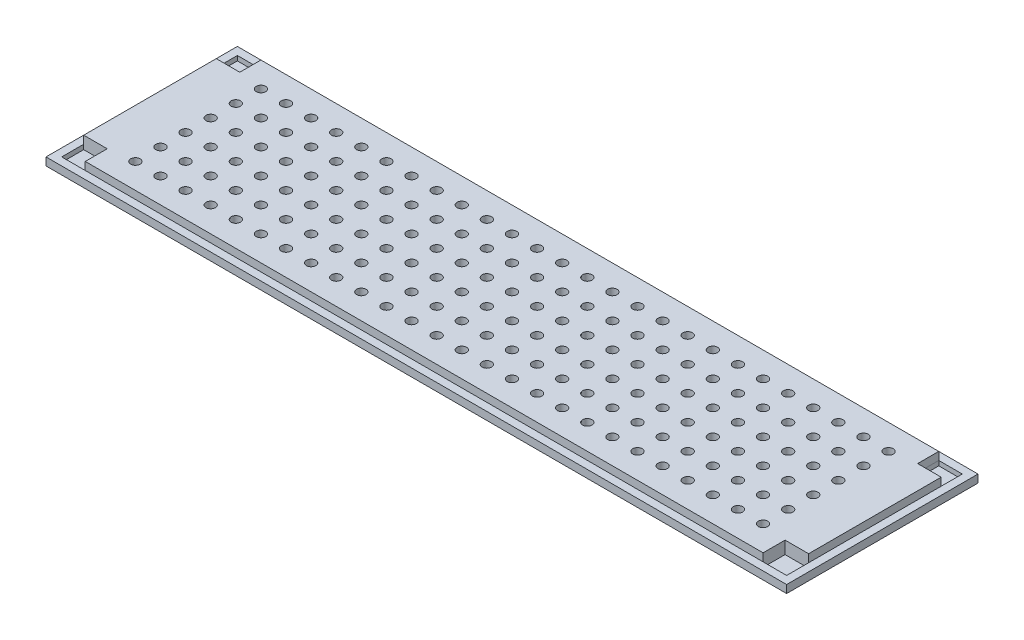
from build123d import *

# Parameters (mm, degrees)
SKETCH1_W           = 236
SKETCH1_H           = 60.98
BOSS_EXTRUDE2_DEPTH = 2.5
BOSS_EXTRUDE3_DEPTH = 2.5
SKETCH4_W           = 7.502299771
SKETCH4_H           = 6.733304844
CUT_EXTRUDE2_DEPTH  = 1.5
SKETCH5_R           = 1.5
CUT_EXTRUDE3_DEPTH  = 10


with BuildPart() as part:
    # Sketch1 → Boss-Extrude2 (new body)
    with BuildSketch(Plane(origin=(0, 0, 0), x_dir=(1, 0, 0), z_dir=(0, 1, 0))):
        Rectangle(SKETCH1_W, SKETCH1_H)
    extrude(amount=BOSS_EXTRUDE2_DEPTH)

    # Sketch2 → Boss-Extrude3 (add)
    with BuildSketch(Plane(origin=(0, 2.5, 0), x_dir=(1, 0, 0), z_dir=(0, 1, 0))):
        Polygon((-107.997700229, 27.99), (-107.997700229, 21.256695156), (-115.5, 21.256695156), (-115.5, -20.985887641), (-107.997700229, -20.985887641), (-107.997700229, -27.985887641), (107.997700229, -27.985887641), (107.997700229, -20.985887641), (115.5, -20.985887641), (115.5, 21.256695156), (108, 21.258101333), (107.997700229, 27.99), align=None)
    extrude(amount=BOSS_EXTRUDE3_DEPTH)

    # Sketch4 → Cut-Extrude2 (cut)
    with BuildSketch(Plane(origin=(0, 2.5, 0), x_dir=(1, 0, 0), z_dir=(0, 1, 0))):
        with Locations((-111.748850115, 24.623347578)):
            Rectangle(SKETCH4_W, SKETCH4_H)
        Polygon((-107.997700229, -21.256695156), (-107.997700229, -27.99), (-115.5, -27.99), (-115.5, -21.256695156), (-115.5, -20.985887641), (-107.997700229, -20.985887641), align=None)
        Polygon((115.5, -21.256695156), (115.5, -20.985887641), (107.997700229, -20.985887641), (107.997700229, -21.256695156), (107.997700229, -27.99), (115.5, -27.99), align=None)
        with Locations((111.748850115, 24.623347578)):
            Rectangle(SKETCH4_W, SKETCH4_H)
    extrude(amount=-CUT_EXTRUDE2_DEPTH, mode=Mode.SUBTRACT)

    # Sketch5 → Cut-Extrude3 (cut)
    with BuildSketch(Plane(origin=(0, 5, 0), x_dir=(1, 0, 0), z_dir=(0, 1, 0))):
        with Locations((-99.997700229, 19.99)):
            Circle(SKETCH5_R)
        with Locations((-91.997700229, 19.99)):
            Circle(SKETCH5_R)
        with Locations((-83.997700229, 19.99)):
            Circle(SKETCH5_R)
        with Locations((-75.997700229, 19.99)):
            Circle(SKETCH5_R)
        with Locations((-67.997700229, 19.99)):
            Circle(SKETCH5_R)
        with Locations((-59.997700229, 19.99)):
            Circle(SKETCH5_R)
        with Locations((-51.997700229, 19.99)):
            Circle(SKETCH5_R)
        with Locations((-43.997700229, 19.99)):
            Circle(SKETCH5_R)
        with Locations((-35.997700229, 19.99)):
            Circle(SKETCH5_R)
        with Locations((-27.997700229, 19.99)):
            Circle(SKETCH5_R)
        with Locations((-19.997700229, 19.99)):
            Circle(SKETCH5_R)
        with Locations((-11.997700229, 19.99)):
            Circle(SKETCH5_R)
        with Locations((-3.997700229, 19.99)):
            Circle(SKETCH5_R)
        with Locations((4.002299771, 19.99)):
            Circle(SKETCH5_R)
        with Locations((12.002299771, 19.99)):
            Circle(SKETCH5_R)
        with Locations((20.002299771, 19.99)):
            Circle(SKETCH5_R)
        with Locations((28.002299771, 19.99)):
            Circle(SKETCH5_R)
        with Locations((36.002299771, 19.99)):
            Circle(SKETCH5_R)
        with Locations((44.002299771, 19.99)):
            Circle(SKETCH5_R)
        with Locations((52.002299771, 19.99)):
            Circle(SKETCH5_R)
        with Locations((60.002299771, 19.99)):
            Circle(SKETCH5_R)
        with Locations((68.002299771, 19.99)):
            Circle(SKETCH5_R)
        with Locations((76.002299771, 19.99)):
            Circle(SKETCH5_R)
        with Locations((84.002299771, 19.99)):
            Circle(SKETCH5_R)
        with Locations((92.002299771, 19.99)):
            Circle(SKETCH5_R)
        with Locations((100.002299771, 19.99)):
            Circle(SKETCH5_R)
        with Locations((-91.997700229, 11.99)):
            Circle(SKETCH5_R)
        with Locations((-83.997700229, 11.99)):
            Circle(SKETCH5_R)
        with Locations((-75.997700229, 11.99)):
            Circle(SKETCH5_R)
        with Locations((-67.997700229, 11.99)):
            Circle(SKETCH5_R)
        with Locations((-59.997700229, 11.99)):
            Circle(SKETCH5_R)
        with Locations((-51.997700229, 11.99)):
            Circle(SKETCH5_R)
        with Locations((-43.997700229, 11.99)):
            Circle(SKETCH5_R)
        with Locations((-35.997700229, 11.99)):
            Circle(SKETCH5_R)
        with Locations((-27.997700229, 11.99)):
            Circle(SKETCH5_R)
        with Locations((-19.997700229, 11.99)):
            Circle(SKETCH5_R)
        with Locations((-11.997700229, 11.99)):
            Circle(SKETCH5_R)
        with Locations((-3.997700229, 11.99)):
            Circle(SKETCH5_R)
        with Locations((4.002299771, 11.99)):
            Circle(SKETCH5_R)
        with Locations((12.002299771, 11.99)):
            Circle(SKETCH5_R)
        with Locations((20.002299771, 11.99)):
            Circle(SKETCH5_R)
        with Locations((28.002299771, 11.99)):
            Circle(SKETCH5_R)
        with Locations((36.002299771, 11.99)):
            Circle(SKETCH5_R)
        with Locations((44.002299771, 11.99)):
            Circle(SKETCH5_R)
        with Locations((52.002299771, 11.99)):
            Circle(SKETCH5_R)
        with Locations((60.002299771, 11.99)):
            Circle(SKETCH5_R)
        with Locations((68.002299771, 11.99)):
            Circle(SKETCH5_R)
        with Locations((76.002299771, 11.99)):
            Circle(SKETCH5_R)
        with Locations((84.002299771, 11.99)):
            Circle(SKETCH5_R)
        with Locations((92.002299771, 11.99)):
            Circle(SKETCH5_R)
        with Locations((100.002299771, 11.99)):
            Circle(SKETCH5_R)
        with Locations((-91.997700229, 3.99)):
            Circle(SKETCH5_R)
        with Locations((-83.997700229, 3.99)):
            Circle(SKETCH5_R)
        with Locations((-75.997700229, 3.99)):
            Circle(SKETCH5_R)
        with Locations((-67.997700229, 3.99)):
            Circle(SKETCH5_R)
        with Locations((-59.997700229, 3.99)):
            Circle(SKETCH5_R)
        with Locations((-51.997700229, 3.99)):
            Circle(SKETCH5_R)
        with Locations((-43.997700229, 3.99)):
            Circle(SKETCH5_R)
        with Locations((-35.997700229, 3.99)):
            Circle(SKETCH5_R)
        with Locations((-27.997700229, 3.99)):
            Circle(SKETCH5_R)
        with Locations((-19.997700229, 3.99)):
            Circle(SKETCH5_R)
        with Locations((-11.997700229, 3.99)):
            Circle(SKETCH5_R)
        with Locations((-3.997700229, 3.99)):
            Circle(SKETCH5_R)
        with Locations((4.002299771, 3.99)):
            Circle(SKETCH5_R)
        with Locations((12.002299771, 3.99)):
            Circle(SKETCH5_R)
        with Locations((20.002299771, 3.99)):
            Circle(SKETCH5_R)
        with Locations((28.002299771, 3.99)):
            Circle(SKETCH5_R)
        with Locations((36.002299771, 3.99)):
            Circle(SKETCH5_R)
        with Locations((44.002299771, 3.99)):
            Circle(SKETCH5_R)
        with Locations((52.002299771, 3.99)):
            Circle(SKETCH5_R)
        with Locations((60.002299771, 3.99)):
            Circle(SKETCH5_R)
        with Locations((68.002299771, 3.99)):
            Circle(SKETCH5_R)
        with Locations((76.002299771, 3.99)):
            Circle(SKETCH5_R)
        with Locations((84.002299771, 3.99)):
            Circle(SKETCH5_R)
        with Locations((92.002299771, 3.99)):
            Circle(SKETCH5_R)
        with Locations((100.002299771, 3.99)):
            Circle(SKETCH5_R)
        with Locations((-91.997700229, -4.01)):
            Circle(SKETCH5_R)
        with Locations((-83.997700229, -4.01)):
            Circle(SKETCH5_R)
        with Locations((-75.997700229, -4.01)):
            Circle(SKETCH5_R)
        with Locations((-67.997700229, -4.01)):
            Circle(SKETCH5_R)
        with Locations((-59.997700229, -4.01)):
            Circle(SKETCH5_R)
        with Locations((-51.997700229, -4.01)):
            Circle(SKETCH5_R)
        with Locations((-43.997700229, -4.01)):
            Circle(SKETCH5_R)
        with Locations((-35.997700229, -4.01)):
            Circle(SKETCH5_R)
        with Locations((-27.997700229, -4.01)):
            Circle(SKETCH5_R)
        with Locations((-19.997700229, -4.01)):
            Circle(SKETCH5_R)
        with Locations((-11.997700229, -4.01)):
            Circle(SKETCH5_R)
        with Locations((-3.997700229, -4.01)):
            Circle(SKETCH5_R)
        with Locations((4.002299771, -4.01)):
            Circle(SKETCH5_R)
        with Locations((12.002299771, -4.01)):
            Circle(SKETCH5_R)
        with Locations((20.002299771, -4.01)):
            Circle(SKETCH5_R)
        with Locations((28.002299771, -4.01)):
            Circle(SKETCH5_R)
        with Locations((36.002299771, -4.01)):
            Circle(SKETCH5_R)
        with Locations((44.002299771, -4.01)):
            Circle(SKETCH5_R)
        with Locations((52.002299771, -4.01)):
            Circle(SKETCH5_R)
        with Locations((60.002299771, -4.01)):
            Circle(SKETCH5_R)
        with Locations((68.002299771, -4.01)):
            Circle(SKETCH5_R)
        with Locations((76.002299771, -4.01)):
            Circle(SKETCH5_R)
        with Locations((84.002299771, -4.01)):
            Circle(SKETCH5_R)
        with Locations((92.002299771, -4.01)):
            Circle(SKETCH5_R)
        with Locations((100.002299771, -4.01)):
            Circle(SKETCH5_R)
        with Locations((-91.997700229, -12.01)):
            Circle(SKETCH5_R)
        with Locations((-83.997700229, -12.01)):
            Circle(SKETCH5_R)
        with Locations((-75.997700229, -12.01)):
            Circle(SKETCH5_R)
        with Locations((-67.997700229, -12.01)):
            Circle(SKETCH5_R)
        with Locations((-59.997700229, -12.01)):
            Circle(SKETCH5_R)
        with Locations((-51.997700229, -12.01)):
            Circle(SKETCH5_R)
        with Locations((-43.997700229, -12.01)):
            Circle(SKETCH5_R)
        with Locations((-35.997700229, -12.01)):
            Circle(SKETCH5_R)
        with Locations((-27.997700229, -12.01)):
            Circle(SKETCH5_R)
        with Locations((-19.997700229, -12.01)):
            Circle(SKETCH5_R)
        with Locations((-11.997700229, -12.01)):
            Circle(SKETCH5_R)
        with Locations((-3.997700229, -12.01)):
            Circle(SKETCH5_R)
        with Locations((4.002299771, -12.01)):
            Circle(SKETCH5_R)
        with Locations((12.002299771, -12.01)):
            Circle(SKETCH5_R)
        with Locations((20.002299771, -12.01)):
            Circle(SKETCH5_R)
        with Locations((28.002299771, -12.01)):
            Circle(SKETCH5_R)
        with Locations((36.002299771, -12.01)):
            Circle(SKETCH5_R)
        with Locations((44.002299771, -12.01)):
            Circle(SKETCH5_R)
        with Locations((52.002299771, -12.01)):
            Circle(SKETCH5_R)
        with Locations((60.002299771, -12.01)):
            Circle(SKETCH5_R)
        with Locations((68.002299771, -12.01)):
            Circle(SKETCH5_R)
        with Locations((76.002299771, -12.01)):
            Circle(SKETCH5_R)
        with Locations((84.002299771, -12.01)):
            Circle(SKETCH5_R)
        with Locations((92.002299771, -12.01)):
            Circle(SKETCH5_R)
        with Locations((100.002299771, -12.01)):
            Circle(SKETCH5_R)
        with Locations((-91.997700229, -20.01)):
            Circle(SKETCH5_R)
        with Locations((-83.997700229, -20.01)):
            Circle(SKETCH5_R)
        with Locations((-75.997700229, -20.01)):
            Circle(SKETCH5_R)
        with Locations((-67.997700229, -20.01)):
            Circle(SKETCH5_R)
        with Locations((-59.997700229, -20.01)):
            Circle(SKETCH5_R)
        with Locations((-51.997700229, -20.01)):
            Circle(SKETCH5_R)
        with Locations((-43.997700229, -20.01)):
            Circle(SKETCH5_R)
        with Locations((-35.997700229, -20.01)):
            Circle(SKETCH5_R)
        with Locations((-27.997700229, -20.01)):
            Circle(SKETCH5_R)
        with Locations((-19.997700229, -20.01)):
            Circle(SKETCH5_R)
        with Locations((-11.997700229, -20.01)):
            Circle(SKETCH5_R)
        with Locations((-3.997700229, -20.01)):
            Circle(SKETCH5_R)
        with Locations((4.002299771, -20.01)):
            Circle(SKETCH5_R)
        with Locations((12.002299771, -20.01)):
            Circle(SKETCH5_R)
        with Locations((20.002299771, -20.01)):
            Circle(SKETCH5_R)
        with Locations((28.002299771, -20.01)):
            Circle(SKETCH5_R)
        with Locations((36.002299771, -20.01)):
            Circle(SKETCH5_R)
        with Locations((44.002299771, -20.01)):
            Circle(SKETCH5_R)
        with Locations((52.002299771, -20.01)):
            Circle(SKETCH5_R)
        with Locations((60.002299771, -20.01)):
            Circle(SKETCH5_R)
        with Locations((68.002299771, -20.01)):
            Circle(SKETCH5_R)
        with Locations((76.002299771, -20.01)):
            Circle(SKETCH5_R)
        with Locations((84.002299771, -20.01)):
            Circle(SKETCH5_R)
        with Locations((92.002299771, -20.01)):
            Circle(SKETCH5_R)
        with Locations((100.002299771, -20.01)):
            Circle(SKETCH5_R)
        with Locations((-99.997700229, 11.99)):
            Circle(SKETCH5_R)
        with Locations((-99.997700229, 3.99)):
            Circle(SKETCH5_R)
        with Locations((-99.997700229, -4.01)):
            Circle(SKETCH5_R)
        with Locations((-99.997700229, -12.01)):
            Circle(SKETCH5_R)
        with Locations((-99.997700229, -20.01)):
            Circle(SKETCH5_R)
    extrude(amount=-CUT_EXTRUDE3_DEPTH, mode=Mode.SUBTRACT)


solid = part.part
